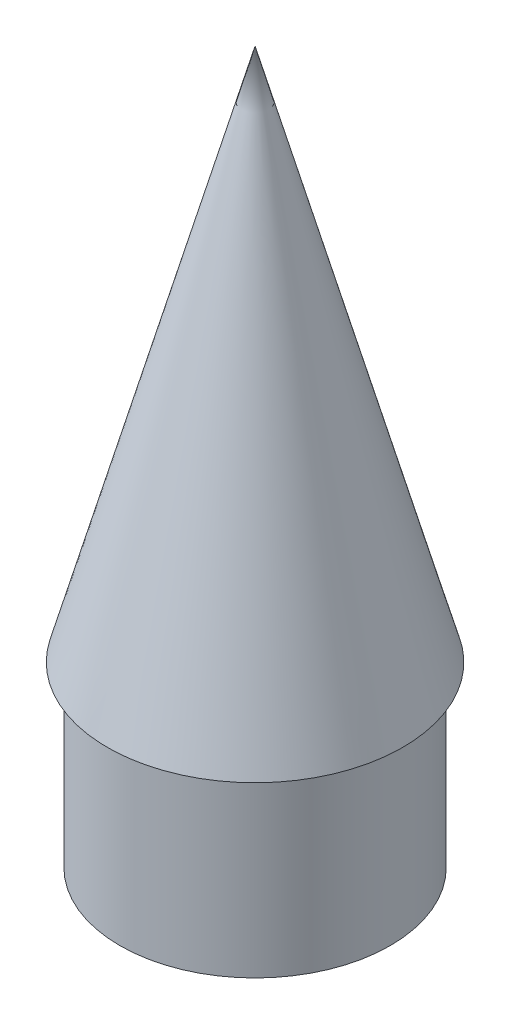
from build123d import *
from build123d.topology import SkipClean


with BuildPart() as part:
    # Sketch1 → Revolve3 (revolve)
    with BuildSketch(Plane.XY):
        Polygon((0, 150), (-41.5, 0), (-33, 0), (-33, 2), (-38.871533471, 2), (0, 142.499518572), align=None)
    revolve(axis=Axis((0, 2, 0), (0, 1, 0)))

    # Sketch2 → Revolve6 (revolve)
    with SkipClean():  # the faces are left unmerged after this step: merging them gives an invalid solid
        with BuildSketch(Plane.XY):
            Polygon((38, 12.65060241), (33, 30.722891566), (33, -50), (38, -50), (38, 0), (41.5, 0), align=None)
        revolve(axis=Axis((0, 0, 0), (0, -1, 0)))


solid = part.part
